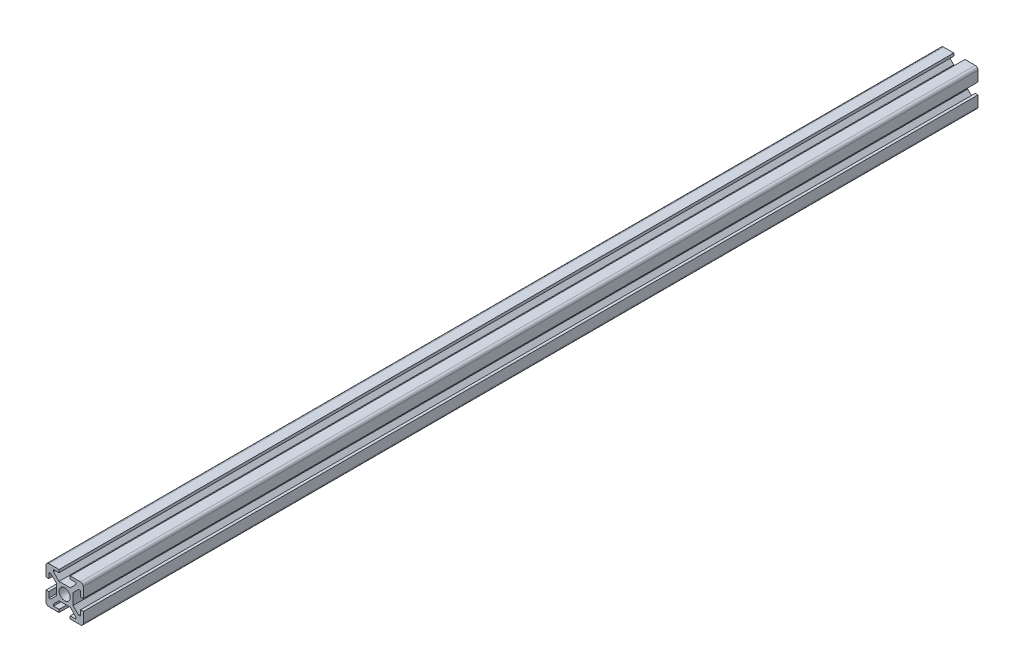
from build123d import *

# Parameters (mm, degrees)
ESQUISSE1_W                  = 20
ESQUISSE1_H                  = 20
EXTRUSION1_DEPTH             = 240
CONG_1_R                     = 1.5
ENL_V_MAT_EXTRU_1_DEPTH      = 481.208288142
R_P_TITION_CIRCULAIRE1_COUNT = 4


with BuildPart() as part:
    # Esquisse1 → Extrusion1 (new, symmetric)
    with BuildSketch(Plane.XY):
        Rectangle(ESQUISSE1_W, ESQUISSE1_H)
    extrude(amount=EXTRUSION1_DEPTH, both=True)

    # Congé1
    cong_1_edges = [part.edges().sort_by_distance(p)[0] for p in [
        (-10, -10, 0),
        (10, -10, 0),
        (-10, 10, 0),
        (10, 10, 0),
    ]]
    fillet(cong_1_edges, radius=CONG_1_R)

    # Esquisse2 → Enlèv. mat.-Extru.1 (cut, through all)
    with BuildSketch(Plane(origin=(0, 0, -240), x_dir=(-1, 0, 0), z_dir=(0, 0, -1))):
        Polygon((-10, 3), (-10, -3), (-8.5, -3), (-8.5, -6), (-7.5, -6), (-4.5, -3), (-4.5, 3), (-7.5, 6), (-8.5, 6), (-8.5, 3), align=None)
    enl_v_mat_extru_1 = extrude(amount=-ENL_V_MAT_EXTRU_1_DEPTH, mode=Mode.SUBTRACT)

    # Répétition circulaire1: Enlèv. mat.-Extru.1 ×4 about axis
    r_p_tition_circulaire1_axis = Axis((0, 0, 9.333809512), (0, 0, -1))
    for i in range(1, R_P_TITION_CIRCULAIRE1_COUNT):
        add(enl_v_mat_extru_1.rotate(r_p_tition_circulaire1_axis, i * 360 / R_P_TITION_CIRCULAIRE1_COUNT), mode=Mode.SUBTRACT)

    # Esquisse5 → Trou taraudé M6x1.01 (revolve, cut)
    with BuildSketch(Plane(origin=(0, 0, -240), x_dir=(0, 1, 0), z_dir=(1, 0, 0))):
        Polygon((0, 0), (0, 31.502151548), (2.5, 30), (2.5, 24), (3, 24), (3, 0), align=None)
    trou_taraud_m6x1_01 = revolve(axis=Axis((0, 0, -246.35), (0, 0, 1)), mode=Mode.SUBTRACT)

    # Symétrie1: Trou taraudé M6x1.01 across plane
    add(trou_taraud_m6x1_01.mirror(Plane.XY), mode=Mode.SUBTRACT)


solid = part.part
